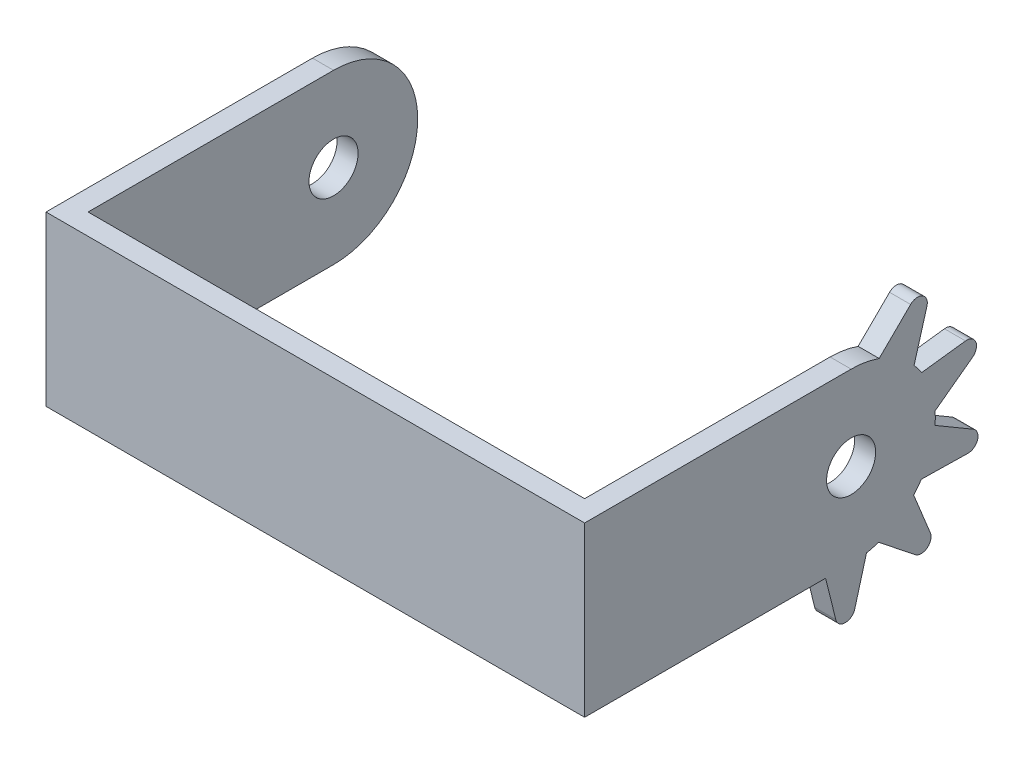
from build123d import *

# Parameters (mm, degrees)
EXTRUDE_2_DEPTH     = 12
FILLET_1_R          = 6
CUT_EXTRUDE_3_REACH = 49.366
SKETCH_5_R          = 1.75
CUT_EXTRUDE_START   = -1.5
SKETCH_6_R          = 1.75
CUT_EXTRUDE_4_DEPTH = 1.5
EXTRUDE_3_DEPTH     = 1.5


with BuildPart() as part:
    # 草图2 → 凸台-拉伸2 (new body)
    with BuildSketch(Plane(origin=(0, 0, 0), x_dir=(1, 0, 0), z_dir=(0, 1, 0))):
        Polygon((0, 0), (38.4, 0), (38.4, 25), (36.9, 25), (36.9, 1.5), (1.5, 1.5), (1.5, 25), (0, 25), align=None)
    extrude(amount=EXTRUDE_2_DEPTH)

    # 圆角1
    fillet_1_edges = [part.edges().sort_by_distance(p)[0] for p in [
        (0.75, 0, -25),
        (0.75, 12, -25),
        (37.65, 0, -25),
        (37.65, 12, -25),
    ]]
    fillet(fillet_1_edges, radius=FILLET_1_R - 0.0001)  # a hair under: the kernel refuses the full size

    # 草图5 → 切除-拉伸3 (cut, up to next)
    with BuildSketch(Plane.ZY, mode=Mode.PRIVATE) as cut_extrude_3_sk1:
        with Locations((-19, 6)):
            Circle(SKETCH_5_R)
    cut_extrude_3_tool1 = extrude(cut_extrude_3_sk1.sketch, amount=-CUT_EXTRUDE_3_REACH, mode=Mode.PRIVATE) & part.part
    add(cut_extrude_3_tool1.solids().sort_by_distance((0, 6, -19))[0], mode=Mode.SUBTRACT)

    # 草图6 → 切除-拉伸4 (cut)
    with BuildSketch(Plane(origin=(38.4, 0, 0), x_dir=(0, 0, -1), z_dir=(1, 0, 0)).offset(CUT_EXTRUDE_START)):
        with Locations(Location((19, 6, 0), (0, 0, 180))):
            Circle(SKETCH_6_R)
    extrude(amount=CUT_EXTRUDE_4_DEPTH, mode=Mode.SUBTRACT)

    # 草图7 → 凸台-拉伸3 (add)
    with BuildSketch(Plane(origin=(38.4, 0, 0), x_dir=(0, 0, -1), z_dir=(1, 0, 0))):
        with BuildLine():
            Line((20.999709003, 11.656957124), (23.241440486, 13.870627343))
            ThreePointArc((23.241440486, 13.870627343), (24.09053112, 13.974522864), (24.406127138, 13.179445297))
            Line((24.406127138, 13.179445297), (23.488407969, 9.981732526))
            ThreePointArc((23.488407969, 9.981732526), (22.350449197, 10.977397932), (20.999709003, 11.656957124))
        make_face()
        with BuildLine():
            Line((27.659538401, 8.404795226), (24.984818637, 6.42655115))
            ThreePointArc((24.984818637, 6.42655115), (24.68813794, 7.909211035), (24.03021312, 9.27062012))
            Line((24.03021312, 9.27062012), (27.156295325, 9.662163121))
            ThreePointArc((27.156295325, 9.662163121), (27.893171802, 9.227695353), (27.659538401, 8.404795226))
        make_face()
        with BuildLine():
            Line((27.334020294, 2.636259354), (24.007743744, 2.695079034))
            ThreePointArc((24.007743744, 2.695079034), (24.674957273, 4.051959971), (24.981763759, 5.53255767))
            Line((24.981763759, 5.53255767), (27.700207796, 3.940151347))
            ThreePointArc((27.700207796, 3.940151347), (28.02032399, 3.146882915), (27.334020294, 2.636259354))
        make_face()
        with BuildLine():
            Line((23.564107276, -1.742064981), (20.961001817, 0.329508674))
            ThreePointArc((20.961001817, 0.329508674), (22.316354676, 0.999820837), (23.461091399, 1.987686013))
            Line((23.461091399, 1.987686013), (24.648382507, -0.93053874))
            ThreePointArc((24.648382507, -0.93053874), (24.419436534, -1.754755292), (23.564107276, -1.742064981))
        make_face()
        with BuildLine():
            Line((17.907879211, -2.920645581), (17.103790939, 0.307514497))
            ThreePointArc((17.103790939, 0.307514497), (18.587124847, 0.014222347), (20.096679766, 0.101076921))
            Line((20.096679766, 0.101076921), (19.262118462, -2.936883465))
            ThreePointArc((19.262118462, -2.936883465), (18.578732164, -3.451404943), (17.907879211, -2.920645581))
        make_face()
    extrude(amount=-EXTRUDE_3_DEPTH)


solid = part.part
